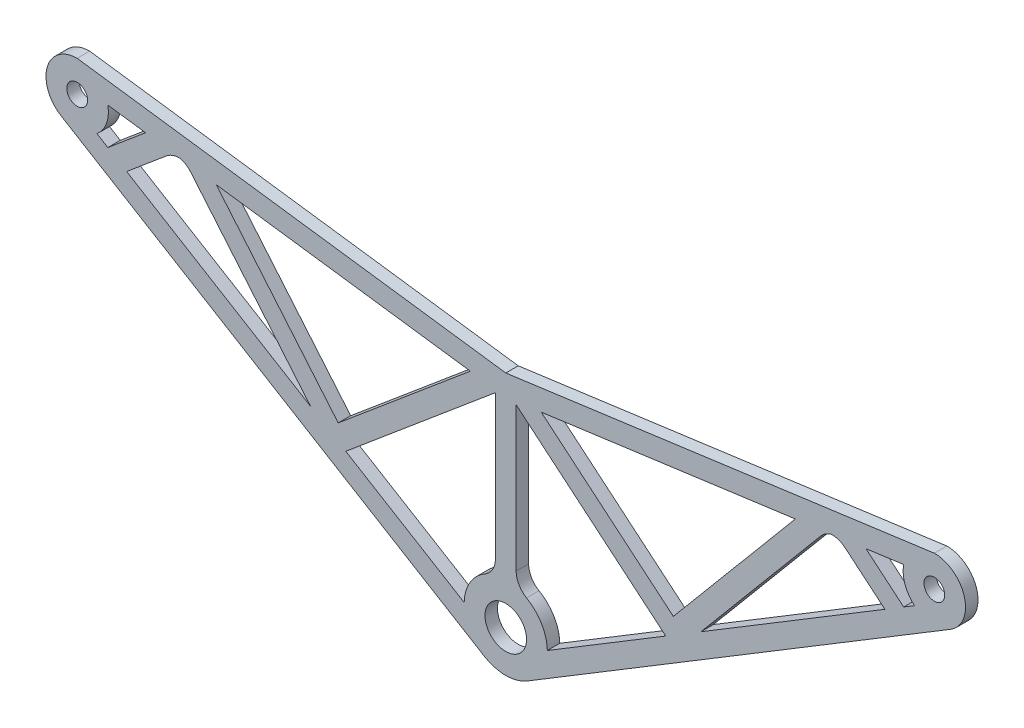
from build123d import *

# Parameters (mm, degrees)
SKETCH_1_R      = 5
EXTRUDE_1_DEPTH = 3
FILLET_1_R      = 5
FILLET_2_R      = 5
FILLET_3_R      = 5


with BuildPart() as part:
    # 草图1 → 凸台-拉伸1 (new body)
    with BuildSketch(Plane.XY):
        with BuildLine():
            Line((101.056239558, 66.72819932), (0, 53))
            Line((0, 53), (-101.056239558, 66.72819932))
            Line((-101.056239558, 66.72819932), (-103.05702305, 67))
            ThreePointArc((-103.05702305, 67), (-110.280675742, 61.517137029), (-106.942649005, 53.085024478))
            Line((-106.942649005, 53.085024478), (-5.180834606, -8.553300696))
            ThreePointArc((-5.180834606, -8.553300696), (-3.881694774, -9.215880082), (-2.5, -9.682458366))
            ThreePointArc((-2.5, -9.682458366), (0, -10), (2.5, -9.682458366))
            ThreePointArc((2.5, -9.682458366), (3.881694774, -9.215880082), (5.180834606, -8.553300696))
            Line((5.180834606, -8.553300696), (106.942649005, 53.085024478))
            ThreePointArc((106.942649005, 53.085024478), (110.280675742, 61.517137029), (103.05702305, 67))
            Line((103.05702305, 67), (101.056239558, 66.72819932))
        make_face()
        Circle(SKETCH_1_R, mode=Mode.SUBTRACT)
        with BuildLine():
            Line((-38.470197272, 17.456153435), (-2.5, 47.638732699))
            Line((-2.5, 47.638732699), (-2.5, 9.682458366))
            ThreePointArc((-2.5, 9.682458366), (-7.840929555, 6.206434058), (-9.997792991, 0.210084034))
            Line((-9.997792991, 0.210084034), (-38.470197272, 17.456153435))
        make_face(mode=Mode.SUBTRACT)
        with BuildLine():
            Line((38.470197272, 17.456153435), (9.997792991, 0.210084034))
            ThreePointArc((9.997792991, 0.210084034), (7.840929555, 6.206434058), (2.5, 9.682458366))
            Line((2.5, 9.682458366), (2.5, 47.638732699))
            Line((2.5, 47.638732699), (38.470197272, 17.456153435))
        make_face(mode=Mode.SUBTRACT)
        Polygon((-76.992375251, 58.413267417), (-46.919815599, 22.574186413), (-91.163166243, 49.372903102), (-79.915961764, 58.810428231), align=None, mode=Mode.SUBTRACT)
        Polygon((-69.625606174, 57.412513038), (-8.52297152, 49.111895964), (-40.292213402, 22.454336819), align=None, mode=Mode.SUBTRACT)
        with BuildLine():
            Line((-95.680736217, 52.109248249), (-98.304134778, 53.698271544))
            ThreePointArc((-98.304134778, 53.698271544), (-95.998027486, 56.966113336), (-95.699425849, 60.954566405))
            Line((-95.699425849, 60.954566405), (-86.610723734, 59.719892378))
            Line((-86.610723734, 59.719892378), (-95.680736217, 52.109248249))
        make_face(mode=Mode.SUBTRACT)
        with BuildLine():
            ThreePointArc((-103.304614869, 61.987709447), (-102.720496256, 61.977246398), (-102.154754916, 61.831504281))
            ThreePointArc((-102.154754916, 61.831504281), (-100.994782723, 60.913210824), (-100.55702305, 59.5))
            ThreePointArc((-100.55702305, 59.5), (-104.73497127, 57.646762354), (-103.304614869, 61.987709447))
        make_face(mode=Mode.SUBTRACT)
        Polygon((40.292213402, 22.454336819), (8.52297152, 49.111895964), (69.625606174, 57.412513038), align=None, mode=Mode.SUBTRACT)
        Polygon((91.163166243, 49.372903102), (46.919815599, 22.574186413), (76.992375251, 58.413267417), (79.915961764, 58.810428231), align=None, mode=Mode.SUBTRACT)
        with BuildLine():
            Line((95.680736217, 52.109248249), (86.610723734, 59.719892378))
            Line((86.610723734, 59.719892378), (95.699425849, 60.954566405))
            ThreePointArc((95.699425849, 60.954566405), (95.998027486, 56.966113336), (98.304134778, 53.698271544))
            Line((98.304134778, 53.698271544), (95.680736217, 52.109248249))
        make_face(mode=Mode.SUBTRACT)
        with BuildLine():
            ThreePointArc((105.55702305, 59.5), (101.643812227, 57.437759673), (102.154754916, 61.831504281))
            ThreePointArc((102.154754916, 61.831504281), (102.720496256, 61.977246398), (103.304614869, 61.987709447))
            ThreePointArc((103.304614869, 61.987709447), (104.910260696, 61.177948219), (105.55702305, 59.5))
        make_face(mode=Mode.SUBTRACT)
    extrude(amount=EXTRUDE_1_DEPTH)

    # 圆角1
    # the kernel refuses this fillet: 5 mm, written as the material it adds along each edge
    with BuildSketch(Plane(origin=(76.992375251, 58.413267417, 0), x_dir=(0.9908985592379703, 0.1346107176272178, 0), z_dir=(0, 0, 1))) as fillet_1_piece_1:
        with BuildLine():
            CenterArc((FILLET_1_R * 0.386508582556, -FILLET_1_R), FILLET_1_R, 90, 42.263889815)
            Line((-FILLET_1_R * 0.286037651021, -FILLET_1_R * 0.259944891443), (0, 0))
            Line((0, 0), (FILLET_1_R * 0.386508582556, 0))
        make_face()
    extrude(amount=3)
    with BuildSketch(Plane(origin=(79.915961764, 58.810428231, 0), x_dir=(0.7660444431189772, -0.6427876096865403, 0), z_dir=(0, 0, 1))) as fillet_1_piece_2:
        with BuildLine():
            CenterArc((FILLET_1_R * 0.442472138408, -FILLET_1_R), FILLET_1_R, 90, 47.736110185)
            Line((-FILLET_1_R * 0.297582970149, -FILLET_1_R * 0.327453766423), (0, 0))
            Line((0, 0), (FILLET_1_R * 0.442472138408, 0))
        make_face()
    extrude(amount=3)

    # 圆角2
    # the kernel refuses this fillet: 5 mm, written as the material it adds along each edge
    with BuildSketch(Plane(origin=(-79.915961764, 58.810428231, 0), x_dir=(0.9908985592379704, -0.13461071762721746, 0), z_dir=(0, 0, 1))) as fillet_2_piece_1:
        with BuildLine():
            CenterArc((FILLET_2_R * 0.442472138408, -FILLET_2_R), FILLET_2_R, 90, 47.736110185)
            Line((-FILLET_2_R * 0.297582970149, -FILLET_2_R * 0.327453766423), (0, 0))
            Line((0, 0), (FILLET_2_R * 0.442472138408, 0))
        make_face()
    extrude(amount=3)
    with BuildSketch(Plane(origin=(-76.992375251, 58.413267417, 0), x_dir=(0.642787609686538, -0.7660444431189791, 0), z_dir=(0, 0, 1))) as fillet_2_piece_2:
        with BuildLine():
            CenterArc((FILLET_2_R * 0.386508582556, -FILLET_2_R), FILLET_2_R, 90, 42.263889815)
            Line((-FILLET_2_R * 0.286037651021, -FILLET_2_R * 0.259944891443), (0, 0))
            Line((0, 0), (FILLET_2_R * 0.386508582556, 0))
        make_face()
    extrude(amount=3)

    # 圆角3
    fillet_3_edges = [part.edges().sort_by_distance(p)[0] for p in [
        (-2.5, 9.682458366, 1.5),
        (2.5, 9.682458366, 1.5),
    ]]
    fillet(fillet_3_edges, radius=FILLET_3_R)


solid = part.part
